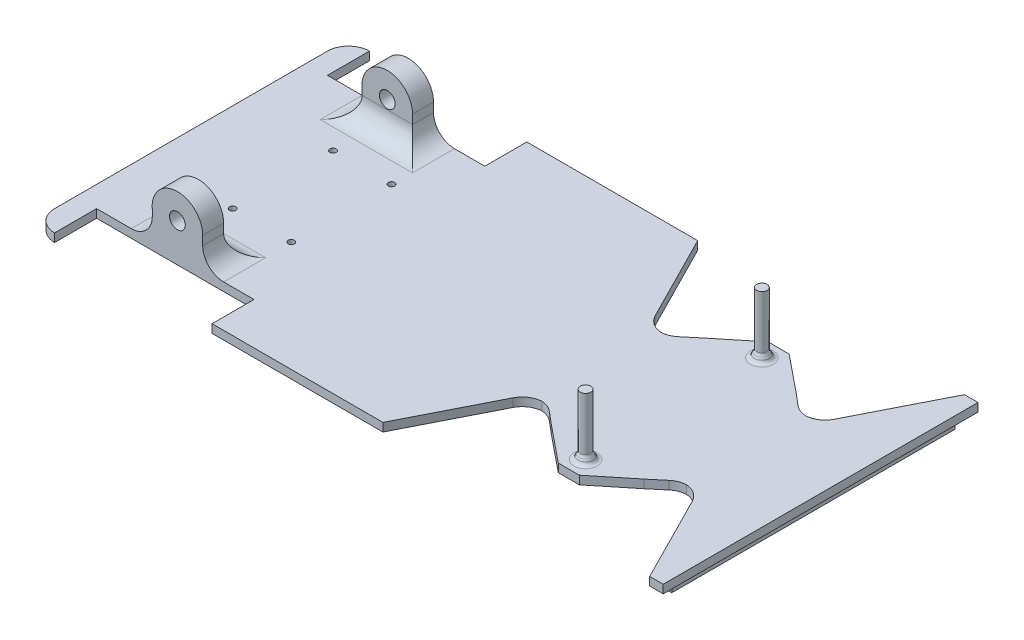
from build123d import *

# Parameters (mm, degrees)
BOSS_EXTRUDE1_DEPTH      = 4
CROQUIS3_W               = 75
CROQUIS3_H               = 20
CORTAR_EXTRUIR1_DEPTH    = 10
CROQUIS4_R               = 3.5
SALIENTE_EXTRUIR1_DEPTH  = 2
CROQUIS5_R               = 2.5
SALIENTE_EXTRUIR2_DEPTH  = 27
CORTAR_EXTRUIR3_DEPTH    = 171.194006945
REDONDEO2_R              = 2
REDONDEO3_R              = 2
REDONDEO4_R              = 2
REDONDEO5_R              = 2
REDONDEO6_R              = 2
REDONDEO7_R              = 10
CROQUIS9_R               = 1.5
CORTAR_EXTRUIR4_DEPTH    = 171.194006945
CROQUIS15_R              = 3.75
SALIENTE_EXTRUIR3_DEPTH  = 10
REDONDEO8_R              = 10
REDONDEO8_OF_SIMETR_A2_R = 10
CROQUIS16_W              = 45.868264646
CROQUIS16_H              = 20
CROQUIS16_W_2            = 25.985344102
CROQUIS16_W_3            = 31
CROQUIS16_W_4            = 32
SALIENTE_EXTRUIR5_DEPTH  = 5


# Some blends are built 0.0001 mm under size
with BuildPart() as part:
    # Sketch1 → Boss-Extrude1 (new body)
    with BuildSketch(Plane(origin=(0, 0, 0), x_dir=(1, 0, 0), z_dir=(0, 1, 0))):
        with BuildLine():
            Line((70, 75), (150, 75))
            Line((150, 75), (150, 65))
            Line((150, 65), (150, -30))
            Line((150, -30), (150, -75))
            Line((150, -75), (70, -75))
            Line((70, -75), (-140, -75))
            ThreePointArc((-140, -75), (-147.071067812, -72.071067812), (-150, -65))
            Line((-150, -65), (-150, 65))
            ThreePointArc((-150, 65), (-147.071067812, 72.071067812), (-140, 75))
            Line((-140, 75), (70, 75))
        make_face()
    extrude(amount=BOSS_EXTRUDE1_DEPTH)

    # Croquis3 → Cortar-Extruir1 (cut)
    with BuildSketch(Plane(origin=(0, 4, 0), x_dir=(1, 0, 0), z_dir=(0, 1, 0))):
        with Locations((-102.5, 65)):
            Rectangle(CROQUIS3_W, CROQUIS3_H)
        with Locations((-102.5, -65)):
            Rectangle(CROQUIS3_W, CROQUIS3_H)
        Polygon((47.925951559, -36.159033642), (16.439774713, -75), (143.560225287, -75), (112.074048441, -36.159033642), (102.074048441, -36.159033642), (85, -50), (75, -50), (57.925951559, -36.159033642), align=None)
        Polygon((143.560225287, 75), (16.439774713, 75), (47.925951559, 36.159033642), (57.925951559, 36.159033642), (75, 50), (85, 50), (102.074048441, 36.159033642), (112.074048441, 36.159033642), align=None)
    cortar_extruir1 = extrude(amount=-CORTAR_EXTRUIR1_DEPTH, mode=Mode.SUBTRACT)

    # Croquis4 → Saliente-Extruir1 (add)
    with BuildSketch(Plane(origin=(0, 4, 0), x_dir=(1, 0, 0), z_dir=(0, 1, 0))):
        with Locations(Location((80, 42, 0), (0, 0, 270))):
            Circle(CROQUIS4_R)
        with Locations(Location((80, -42, 0), (0, 0, 90))):
            Circle(CROQUIS4_R)
    extrude(amount=SALIENTE_EXTRUIR1_DEPTH)

    # Croquis5 → Saliente-Extruir2 (add)
    with BuildSketch(Plane(origin=(0, 6, 0), x_dir=(1, 0, 0), z_dir=(0, 1, 0))):
        with Locations(Location((80, 42, 0), (0, 0, 270))):
            Circle(CROQUIS5_R)
        with Locations(Location((80, -42, 0), (0, 0, 90))):
            Circle(CROQUIS5_R)
    extrude(amount=SALIENTE_EXTRUIR2_DEPTH)

    # Croquis7 → Cortar-Extruir3 (cut, through all)
    with BuildSketch(Plane(origin=(0, 4, 0), x_dir=(1, 0, 0), z_dir=(0, 1, 0))):
        Polygon((57.925951559, 36.159033642), (48.662122101, 28.38575776), (40.074307196, 28.38575776), (16.439774713, 75), align=None)
        Polygon((16.439774713, -75), (57.925951559, -36.159033642), (48.662122101, -28.38575776), (40.074307196, -28.38575776), align=None)
        Polygon((143.560225287, 75), (102.074048441, 36.159033642), (111.337877899, 28.38575776), (119.925692804, 28.38575776), align=None)
        Polygon((102.074048441, -36.159033642), (111.337877899, -28.38575776), (119.925692804, -28.38575776), (143.560225287, -75), align=None)
    extrude(amount=-CORTAR_EXTRUIR3_DEPTH, mode=Mode.SUBTRACT)

    # Redondeo2
    redondeo2_edges = [part.edges().sort_by_distance(p)[0] for p in [
        (80, 4, -45.5),
    ]]
    fillet(redondeo2_edges, radius=REDONDEO2_R - 0.0001)  # a hair under: the kernel refuses the full size

    # Redondeo3
    # the kernel refuses this fillet: 2 mm, written as the material it adds along each edge
    with BuildSketch(Plane(origin=(80, 6, -42), x_dir=(0, 0, 1), z_dir=(-1, 0, 0))) as redondeo3_piece_1:
        with BuildLine():
            CenterArc((4.5, 1.732050808), REDONDEO3_R, 180, 60)
            Line((2.5, 1.732050808), (2.46, 1.732050808))
            Line((2.46, 1.732050808), (2.46, 0))
            Line((2.46, 0), (2.5, -0.04))
            ThreePointArc((2.5, -0.04), (3, -0.04), (3.48, -0.034641016))
            Line((3.48, -0.034641016), (3.5, 0))
        make_face()
    revolve(axis=Axis((80, 6, -42), (0, 1, 0)))

    # Redondeo4
    redondeo4_edges = [part.edges().sort_by_distance(p)[0] for p in [
        (80, 6, -45.5),
    ]]
    fillet(redondeo4_edges, radius=REDONDEO4_R)

    # Redondeo5
    # the kernel refuses this fillet: 2 mm, written as the material it adds along each edge
    with BuildSketch(Plane(origin=(80, 4, 42), x_dir=(0, 0, -1), z_dir=(1, 0, 0))) as redondeo5_piece_1:
        with BuildLine():
            CenterArc((3.5 + REDONDEO5_R, REDONDEO5_R), REDONDEO5_R, 180, 90)
            Line((3.5, REDONDEO5_R), (3.5 - REDONDEO5_R * 0.02, REDONDEO5_R))
            Line((3.5 - REDONDEO5_R * 0.02, REDONDEO5_R), (3.5 - REDONDEO5_R * 0.02, -REDONDEO5_R * 0.02))
            Line((3.5 - REDONDEO5_R * 0.02, -REDONDEO5_R * 0.02), (3.5 + REDONDEO5_R, -REDONDEO5_R * 0.02))
            Line((3.5 + REDONDEO5_R, -REDONDEO5_R * 0.02), (3.5 + REDONDEO5_R, 0))
        make_face()
    revolve(axis=Axis((80, 4, 42), (0, 1, 0)))
    with BuildSketch(Plane(origin=(80, 6, 42), x_dir=(0, 0, -1), z_dir=(1, 0, 0))) as redondeo5_piece_2:
        with BuildLine():
            CenterArc((4.5, 1.732050808), REDONDEO5_R, 180, 60)
            Line((2.5, 1.732050808), (2.46, 1.732050808))
            Line((2.46, 1.732050808), (2.46, 0))
            Line((2.46, 0), (2.5, -0.04))
            ThreePointArc((2.5, -0.04), (3, -0.04), (3.48, -0.034641016))
            Line((3.48, -0.034641016), (3.5, 0))
        make_face()
    revolve(axis=Axis((80, 6, 42), (0, 1, 0)))

    # Redondeo6
    redondeo6_edges = [part.edges().sort_by_distance(p)[0] for p in [
        (80, 6, 45.5),
    ]]
    fillet(redondeo6_edges, radius=REDONDEO6_R)

    # Redondeo7
    # the kernel refuses this fillet: 10 mm, written as the material it adds along each edge
    with BuildSketch(Plane(origin=(40.074307196, 4, 28.38575776), x_dir=(-0.4522182722164984, 0, 0.8919073013904107), z_dir=(0, -1, 0)), Plane(origin=(119.925692804, 4, 28.38575776), x_dir=(-1, 0, 0), z_dir=(0, -1, 0))) as redondeo7_piece_1:
        with BuildLine():
            CenterArc((REDONDEO7_R * 0.614168901779, -REDONDEO7_R), REDONDEO7_R, 90, 63.113904691)
            Line((-REDONDEO7_R * 0.277738399612, -REDONDEO7_R * 0.547781727784), (0, 0))
            Line((0, 0), (REDONDEO7_R * 0.614168901779, 0))
        make_face()
    extrude(amount=4)
    with BuildSketch(Plane(origin=(48.662122101, 4, 28.38575776), x_dir=(-1, 0, 0), z_dir=(0, -1, 0)), Plane(origin=(111.337877899, 4, 28.38575776), x_dir=(-0.7660444431189768, 0, 0.6427876096865409), z_dir=(0, -1, 0))) as redondeo7_piece_2:
        with BuildLine():
            CenterArc((REDONDEO7_R * 0.363970234266, -REDONDEO7_R), REDONDEO7_R, 90, 40)
            Line((-REDONDEO7_R * 0.27881737542, -REDONDEO7_R * 0.233955556881), (0, 0))
            Line((0, 0), (REDONDEO7_R * 0.363970234266, 0))
        make_face()
    extrude(amount=4)
    with BuildSketch(Plane(origin=(40.074307196, 4, -28.38575776), x_dir=(-0.4522182722164984, 0, -0.8919073013904107), z_dir=(0, -1, 0)), Plane(origin=(119.925692804, 4, -28.38575776), x_dir=(-1, 0, 0), z_dir=(0, -1, 0))) as redondeo7_piece_3:
        with BuildLine():
            CenterArc((REDONDEO7_R * 0.614168901779, REDONDEO7_R), REDONDEO7_R, 206.886095309, 63.113904691)
            Line((-REDONDEO7_R * 0.277738399612, REDONDEO7_R * 0.547781727784), (0, 0))
            Line((0, 0), (REDONDEO7_R * 0.614168901779, 0))
        make_face()
    extrude(amount=4)
    with BuildSketch(Plane(origin=(48.662122101, 4, -28.38575776), x_dir=(-1, 0, 0), z_dir=(0, -1, 0)), Plane(origin=(111.337877899, 4, -28.38575776), x_dir=(-0.7660444431189768, 0, -0.6427876096865409), z_dir=(0, -1, 0))) as redondeo7_piece_4:
        with BuildLine():
            CenterArc((REDONDEO7_R * 0.363970234266, REDONDEO7_R), REDONDEO7_R, 230, 40)
            Line((-REDONDEO7_R * 0.27881737542, REDONDEO7_R * 0.233955556881), (0, 0))
            Line((0, 0), (REDONDEO7_R * 0.363970234266, 0))
        make_face()
    extrude(amount=4)

    # Croquis9 → Cortar-Extruir4 (cut, through all)
    with BuildSketch(Plane(origin=(0, 4, 0), x_dir=(1, 0, 0), z_dir=(0, 1, 0))):
        with Locations(Location((-107.59, 25.23, 0), (0, 0, 270))):
            Circle(CROQUIS9_R)
        with Locations(Location((-79.79, 25.33, 0), (0, 0, 270))):
            Circle(CROQUIS9_R)
        with Locations(Location((-79.79, -22.45, 0), (0, 0, 270))):
            Circle(CROQUIS9_R)
        with Locations(Location((-107.59, -22.57, 0), (0, 0, 270))):
            Circle(CROQUIS9_R)
    extrude(amount=-CORTAR_EXTRUIR4_DEPTH, mode=Mode.SUBTRACT)

    # Croquis15 → Saliente-Extruir3 (add)
    with BuildSketch(Plane(origin=(0, 0, -55), x_dir=(-1, 0, 0), z_dir=(0, 0, -1))):
        with BuildLine():
            Line((89.459684655, 4), (89.459684655, 18.25))
            ThreePointArc((89.459684655, 18.25), (102.19671333, 30.27014077), (113.459684655, 16.858908145))
            Line((113.459684655, 16.858908145), (113.459684655, 4))
            Line((113.459684655, 4), (89.459684655, 4))
        make_face()
        with Locations((101.5, 18.25)):
            Circle(CROQUIS15_R, mode=Mode.SUBTRACT)
    saliente_extruir3 = extrude(amount=-SALIENTE_EXTRUIR3_DEPTH)

    # Redondeo8
    redondeo8_edges = [part.edges().sort_by_distance(p)[0] for p in [
        (-113.459684655, 4, -50),
        (-89.459684655, 4, -50),
        (-101.459684655, 4, -45),
    ]]
    fillet(redondeo8_edges, radius=REDONDEO8_R)

    # Simetría2: Cortar-Extruir1, Saliente-Extruir3 across plane
    add(cortar_extruir1.mirror(Plane.XY), mode=Mode.SUBTRACT)
    add(saliente_extruir3.mirror(Plane.XY))

    # Redondeo8 of Simetría2
    redondeo8_of_simetr_a2_edges = [part.edges().sort_by_distance(p)[0] for p in [
        (-113.459684655, 4, 50),
        (-89.459684655, 4, 50),
        (-101.459684655, 4, 45),
    ]]
    fillet(redondeo8_of_simetr_a2_edges, radius=REDONDEO8_OF_SIMETR_A2_R)

    # Croquis16 → Saliente-Extruir5 (add)
    with BuildSketch(Plane.XZ):
        Polygon((-94.131735354, 47.5), (-94.131735354, 14), (-140, 14), (-140, 47.5), (-144, 47.5), (-144, -47.5), (-140, -47.5), (-140, -14), (-94.131735354, -14), (-94.131735354, -47.5), (-90.131735354, -47.5), (-90.131735354, -14), (-44.263470708, -14), (-44.263470708, -47.5), (-40.263470708, -47.5), (-40.263470708, -14), (5.604793938, -14), (5.604793938, -47.5), (9.604793938, -47.5), (9.604793938, -14), (40.604793938, -14), (40.604793938, -22.5), (44.604793938, -22.5), (44.604793938, -14), (76.604793938, -14), (76.604793938, -22.5), (80.604793938, -22.5), (80.604793938, -14), (112.604793938, -14), (112.604793938, -22.5), (116.604793938, -22.5), (116.604793938, -14), (142.59013804, -14), (142.59013804, -67.5), (146.59013804, -67.5), (146.59013804, -14), (146.59013804, 10), (146.59013804, 14), (146.59013804, 67.5), (142.59013804, 67.5), (142.59013804, 14), (116.604793938, 14), (116.604793938, 22.5), (112.604793938, 22.5), (112.604793938, 14), (80.604793938, 14), (80.604793938, 22.5), (76.604793938, 22.5), (76.604793938, 14), (44.604793938, 14), (44.604793938, 22.5), (40.604793938, 22.5), (40.604793938, 14), (9.604793938, 14), (9.604793938, 47.5), (5.604793938, 47.5), (5.604793938, 14), (-40.263470708, 14), (-40.263470708, 47.5), (-44.263470708, 47.5), (-44.263470708, 14), (-90.131735354, 14), (-90.131735354, 47.5), align=None)
        with Locations((-117.065867677, 0)):
            Rectangle(CROQUIS16_W, CROQUIS16_H, mode=Mode.SUBTRACT)
        with Locations((129.597465989, 0)):
            Rectangle(CROQUIS16_W_2, CROQUIS16_H, mode=Mode.SUBTRACT)
        with Locations((25.104793938, 0)):
            Rectangle(CROQUIS16_W_3, CROQUIS16_H, mode=Mode.SUBTRACT)
        with Locations((60.604793938, 0)):
            Rectangle(CROQUIS16_W_4, CROQUIS16_H, mode=Mode.SUBTRACT)
        with Locations((96.604793938, 0)):
            Rectangle(CROQUIS16_W_4, CROQUIS16_H, mode=Mode.SUBTRACT)
        with Locations((-17.329338385, 0)):
            Rectangle(CROQUIS16_W, CROQUIS16_H, mode=Mode.SUBTRACT)
        with Locations((-67.197603031, 0)):
            Rectangle(CROQUIS16_W, CROQUIS16_H, mode=Mode.SUBTRACT)
    extrude(amount=SALIENTE_EXTRUIR5_DEPTH)


solid = part.part
